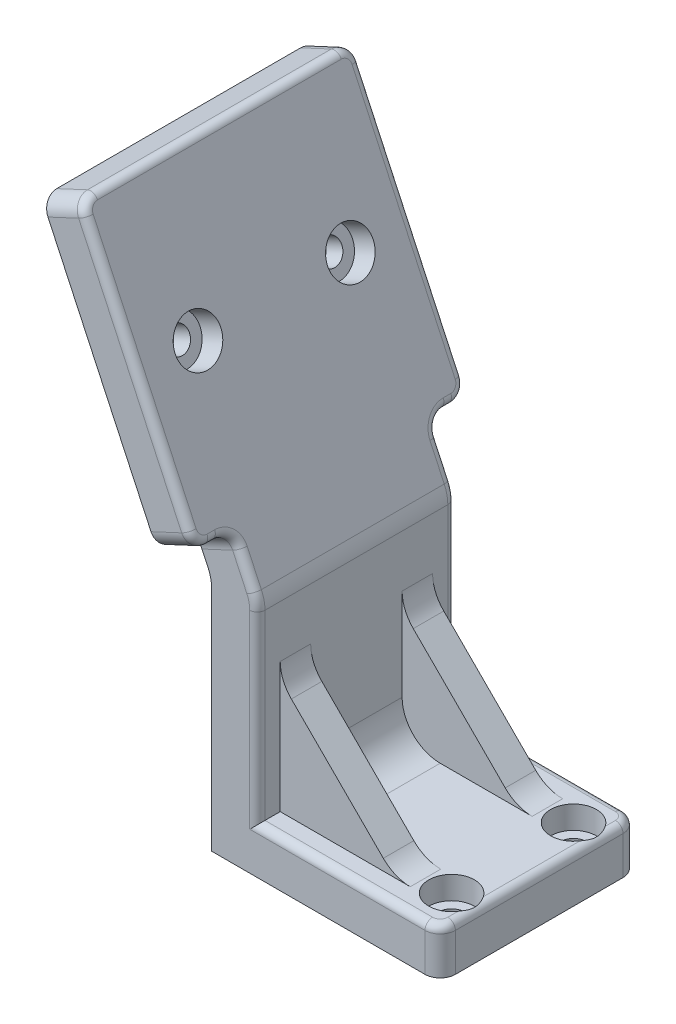
from build123d import *

# Parameters (mm, degrees)
SKETCH_1_W          = 30
SKETCH_1_H          = 26
SKETCH_1_R          = 1.7
EXTRUDE_1_DEPTH     = 6
SKETCH_15_W         = 6
SKETCH_15_H         = 26
EXTRUDE_4_DEPTH     = 25
EXTRUDE_5_DEPTH     = 26
SKETCH_17_W         = 36
SKETCH_17_H         = 36
SKETCH_17_R         = 1.6
EXTRUDE_6_DEPTH     = 5.437846722
FILLET_3_R          = 2
SKETCH_18_R         = 3
CUT_EXTRUDE_4_DEPTH = 3
SKETCH_19_R         = 3
CUT_EXTRUDE_5_DEPTH = 3
FILLET_4_R          = 1
FILLET_6_R          = 5
EXTRUDE_7_DEPTH     = 2
FILLET_7_R          = 5
FILLET_8_R          = 5


with BuildPart() as part:
    # 草图1 → 凸台-拉伸1 (new body)
    with BuildSketch(Plane(origin=(0, 0, 0), x_dir=(1, 0, 0), z_dir=(0, 1, 0))):
        Rectangle(SKETCH_1_W, SKETCH_1_H)
        with Locations(Location((11.5, 8, 0), (0, 0, 270))):
            Circle(SKETCH_1_R, mode=Mode.SUBTRACT)
        with Locations(Location((11.5, -8, 0), (0, 0, 90))):
            Circle(SKETCH_1_R, mode=Mode.SUBTRACT)
    extrude(amount=EXTRUDE_1_DEPTH)

    # 草图15 → 凸台-拉伸4 (add)
    with BuildSketch(Plane(origin=(0, 6, 0), x_dir=(1, 0, 0), z_dir=(0, 1, 0))):
        with Locations((-12, 0)):
            Rectangle(SKETCH_15_W, SKETCH_15_H)
    extrude(amount=EXTRUDE_4_DEPTH)

    # 草图16 → 凸台-拉伸5 (add)
    with BuildSketch(Plane.XY.offset(13)):
        Polygon((-9, 31), (-12.18472848, 37.829672265), (-17.113091309, 35.531538935), (-15, 31), align=None)
    extrude(amount=-EXTRUDE_5_DEPTH)

    # 草图17 → 凸台-拉伸6 (add)
    with BuildSketch(Plane(origin=(-0.447218204, -0.208541274, 0), x_dir=(0, 0, 1), z_dir=(-0.906307787036653, -0.4226182617406928, 0))):
        with Locations((0, 57.434815324)):
            Rectangle(SKETCH_17_W, SKETCH_17_H)
        with Locations(Location((10, 57.434815324, 0), (0, 0, 270))):
            Circle(SKETCH_17_R, mode=Mode.SUBTRACT)
        with Locations(Location((-10, 57.434815324, 0), (0, 0, 90))):
            Circle(SKETCH_17_R, mode=Mode.SUBTRACT)
    extrude(amount=-EXTRUDE_6_DEPTH)

    # 圆角3
    fillet_3_edges = [part.edges().sort_by_distance(p)[0] for p in [
        (-14.648909894, 36.6806056, 13),
        (-14.648909894, 36.6806056, -13),
        (-14.648909894, 36.6806056, 18),
        (-29.863167317, 69.307685933, 18),
        (-14.648909894, 36.6806056, -18),
        (-29.863167317, 69.307685933, -18),
        (15, 3, 13),
        (15, 3, -13),
    ]]
    fillet(fillet_3_edges, radius=FILLET_3_R)

    # 草图18 → 切除-拉伸4 (cut)
    with BuildSketch(Plane(origin=(4.481144625, 2.089592056, 0), x_dir=(0, 0, -1), z_dir=(0.9063077870366527, 0.42261826174069367, 0))):
        with Locations(Location((-10, 57.434815324, 0), (0, 0, 90))):
            Circle(SKETCH_18_R)
        with Locations(Location((10, 57.434815324, 0), (0, 0, 90))):
            Circle(SKETCH_18_R)
    extrude(amount=-CUT_EXTRUDE_4_DEPTH, mode=Mode.SUBTRACT)

    # 草图19 → 切除-拉伸5 (cut)
    with BuildSketch(Plane(origin=(0, 6, 0), x_dir=(1, 0, 0), z_dir=(0, 1, 0))):
        with Locations(Location((11.5, 8, 0), (0, 0, 270))):
            Circle(SKETCH_19_R)
        with Locations(Location((11.5, -8, 0), (0, 0, 270))):
            Circle(SKETCH_19_R)
    extrude(amount=-CUT_EXTRUDE_5_DEPTH, mode=Mode.SUBTRACT)

    # 圆角4
    # the kernel refuses this fillet: 1 mm, written as the material it takes off along each edge
    with BuildSketch(Plane(origin=(13, 6, 13), x_dir=(0, -1, 0), z_dir=(-1, 0, 0)), Plane(origin=(-9, 6, -13), x_dir=(0, -1, 0), z_dir=(1, 0, 0))) as fillet_4_piece_1:
        with BuildLine():
            CenterArc((FILLET_4_R, -FILLET_4_R), FILLET_4_R, 90, 90)
            Line((0, -FILLET_4_R), (0, 0))
            Line((0, 0), (FILLET_4_R, 0))
        make_face()
    extrude(amount=22, mode=Mode.SUBTRACT)
    with BuildSketch(Plane(origin=(-9, 6, 13), x_dir=(-1, 0, 0), z_dir=(0, 1, 0))) as fillet_4_piece_2:
        with BuildLine():
            CenterArc((FILLET_4_R, -FILLET_4_R), FILLET_4_R, 90, 90)
            Line((0, -FILLET_4_R), (0, 0))
            Line((0, 0), (FILLET_4_R, 0))
        make_face()
    extrude(amount=27.5, mode=Mode.SUBTRACT)
    with BuildSketch(Plane(origin=(-9, 6, -13), x_dir=(-1, 0, 0), z_dir=(0, 1, 0))) as fillet_4_piece_3:
        with BuildLine():
            CenterArc((FILLET_4_R, FILLET_4_R), FILLET_4_R, 180, 90)
            Line((0, FILLET_4_R), (0, 0))
            Line((0, 0), (FILLET_4_R, 0))
        make_face()
    extrude(amount=27.5, mode=Mode.SUBTRACT)
    with BuildSketch(Plane(origin=(-7.943454346, 28.734230532, 13), x_dir=(0, 0, -1), z_dir=(-0.4226182617406934, 0.9063077870366528, 0))) as fillet_4_piece_4:
        with BuildLine():
            CenterArc((FILLET_4_R, FILLET_4_R), FILLET_4_R, 180, 90)
            Line((0, FILLET_4_R), (0, 0))
            Line((0, 0), (FILLET_4_R, 0))
        make_face()
    extrude(amount=8.035709571, mode=Mode.SUBTRACT)
    with BuildSketch(Plane(origin=(-7.943454346, 28.734230532, -13), x_dir=(0, 0, 1), z_dir=(-0.4226182617406934, 0.9063077870366528, 0))) as fillet_4_piece_5:
        with BuildLine():
            CenterArc((FILLET_4_R, -FILLET_4_R), FILLET_4_R, 90, 90)
            Line((0, -FILLET_4_R), (0, 0))
            Line((0, 0), (FILLET_4_R, 0))
        make_face()
    extrude(amount=8.035709571, mode=Mode.SUBTRACT)
    with BuildSketch(Plane(origin=(15, 6, -11), x_dir=(-1, 0, 0), z_dir=(0, 0, 1))) as fillet_4_piece_6:
        with BuildLine():
            CenterArc((FILLET_4_R, FILLET_4_R), FILLET_4_R, 180, 90)
            Line((0, FILLET_4_R), (0, 0))
            Line((0, 0), (FILLET_4_R, 0))
        make_face()
    extrude(amount=22, mode=Mode.SUBTRACT)
    with BuildSketch(Plane(origin=(13, 6, 11), x_dir=(0, 0, 1), z_dir=(-1, 0, 0))) as fillet_4_piece_7:
        with BuildLine():
            CenterArc((2 - FILLET_4_R, -FILLET_4_R), FILLET_4_R, 0, 90)
            Line((2, -FILLET_4_R), (2, 0))
            Line((2, 0), (2 - FILLET_4_R, 0))
        make_face()
    revolve(axis=Axis((13, 6, 11), (0, 1, 0)), revolution_arc=90, mode=Mode.SUBTRACT)
    with BuildSketch(Plane(origin=(13, 6, -11), x_dir=(0, 0, -1), z_dir=(-1, 0, 0))) as fillet_4_piece_8:
        with BuildLine():
            CenterArc((2 - FILLET_4_R, FILLET_4_R), FILLET_4_R, 270, 90)
            Line((2 - FILLET_4_R, 0), (2, 0))
            Line((2, 0), (2, FILLET_4_R))
        make_face()
    revolve(axis=Axis((13, 6, -11), (0, -1, 0)), revolution_arc=90, mode=Mode.SUBTRACT)
    with BuildSketch(Plane(origin=(-12.18472848, 37.829672264, -15), x_dir=(-0.42261826174069467, 0.9063077870366523, 0), z_dir=(0, 0, -1)), Plane(origin=(-12.18472848, 37.829672264, 16), x_dir=(-0.42261826174069467, 0.9063077870366523, 0), z_dir=(0, 0, -1))) as fillet_4_piece_9:
        with BuildLine():
            CenterArc((FILLET_4_R, -FILLET_4_R), FILLET_4_R, 90, 90)
            Line((0, -FILLET_4_R), (0, 0))
            Line((0, 0), (FILLET_4_R, 0))
        make_face()
    extrude(amount=1, mode=Mode.SUBTRACT)
    with BuildSketch(Plane(origin=(-26.553749379, 68.644137024, 18), x_dir=(0, 0, -1), z_dir=(0.4226182617406928, -0.906307787036653, 0)), Plane(origin=(-13.029965003, 39.642287839, -18), x_dir=(0, 0, 1), z_dir=(-0.4226182617406928, 0.906307787036653, 0))) as fillet_4_piece_10:
        with BuildLine():
            CenterArc((FILLET_4_R, -FILLET_4_R), FILLET_4_R, 90, 90)
            Line((0, -FILLET_4_R), (0, 0))
            Line((0, 0), (FILLET_4_R, 0))
        make_face()
    extrude(amount=32, mode=Mode.SUBTRACT)
    with BuildSketch(Plane(origin=(-27.398985903, 70.456752598, -16), x_dir=(-0.9063077870366528, -0.4226182617406932, 0), z_dir=(0, 0, 1))) as fillet_4_piece_11:
        with BuildLine():
            CenterArc((FILLET_4_R, FILLET_4_R), FILLET_4_R, 180, 90)
            Line((0, FILLET_4_R), (0, 0))
            Line((0, 0), (FILLET_4_R, 0))
        make_face()
    extrude(amount=32, mode=Mode.SUBTRACT)
    with BuildSketch(Plane(origin=(-26.553749379, 68.644137024, -16), x_dir=(-0.42261826174069317, 0.9063077870366529, 0), z_dir=(0, 0, 1))) as fillet_4_piece_12:
        with BuildLine():
            CenterArc((2 - FILLET_4_R, FILLET_4_R), FILLET_4_R, 270, 90)
            Line((2 - FILLET_4_R, 0), (2, 0))
            Line((2, 0), (2, FILLET_4_R))
        make_face()
    revolve(axis=Axis((-26.553749379, 68.644137024, -16), (-0.906307787036653, -0.4226182617406928, 0)), revolution_arc=90, mode=Mode.SUBTRACT)
    with BuildSketch(Plane(origin=(-13.029965003, 39.642287839, -16), x_dir=(0, 0, -1), z_dir=(-0.4226182617406928, 0.906307787036653, 0))) as fillet_4_piece_13:
        with BuildLine():
            CenterArc((2 - FILLET_4_R, FILLET_4_R), FILLET_4_R, 270, 90)
            Line((2, FILLET_4_R), (2, 0))
            Line((2, 0), (2 - FILLET_4_R, 0))
        make_face()
    revolve(axis=Axis((-13.029965003, 39.642287839, -16), (-0.906307787036653, -0.4226182617406928, 0)), revolution_arc=90, mode=Mode.SUBTRACT)
    with BuildSketch(Plane(origin=(-13.029965003, 39.642287839, 16), x_dir=(0, 0, 1), z_dir=(-0.4226182617406928, 0.906307787036653, 0))) as fillet_4_piece_14:
        with BuildLine():
            CenterArc((2 - FILLET_4_R, -FILLET_4_R), FILLET_4_R, 360, 90)
            Line((2, -FILLET_4_R), (2, 0))
            Line((2, 0), (2 - FILLET_4_R, 0))
        make_face()
    revolve(axis=Axis((-13.029965003, 39.642287839, 16), (0.906307787036653, 0.4226182617406928, 0)), revolution_arc=90, mode=Mode.SUBTRACT)
    with BuildSketch(Plane(origin=(-26.553749379, 68.644137024, 16), x_dir=(-0.42261826174069317, 0.9063077870366529, 0), z_dir=(0, 0, -1))) as fillet_4_piece_15:
        with BuildLine():
            CenterArc((2 - FILLET_4_R, -FILLET_4_R), FILLET_4_R, 0, 90)
            Line((2 - FILLET_4_R, 0), (2, 0))
            Line((2, 0), (2, -FILLET_4_R))
        make_face()
    revolve(axis=Axis((-26.553749379, 68.644137024, 16), (0.906307787036653, 0.4226182617406928, 0)), revolution_arc=90, mode=Mode.SUBTRACT)
    with BuildSketch(Plane(origin=(-11.339491956, 36.01705669, -15), x_dir=(-0.42261826174069395, 0.9063077870366527, 0), z_dir=(0, 0, -1))) as fillet_4_piece_16:
        with BuildLine():
            CenterArc((2 + FILLET_4_R, -FILLET_4_R), FILLET_4_R, 90, 90)
            Line((2, -FILLET_4_R), (2, 0))
            Line((2, 0), (2 + FILLET_4_R, 0))
        make_face()
    revolve(axis=Axis((-11.339491956, 36.01705669, -15), (0.9063077870366527, 0.42261826174069356, 0)), revolution_arc=90, mode=Mode.SUBTRACT)
    with BuildSketch(Plane(origin=(-11.339491956, 36.01705669, 15), x_dir=(-0.42261826174069395, 0.9063077870366527, 0), z_dir=(0, 0, 1))) as fillet_4_piece_17:
        with BuildLine():
            CenterArc((2 + FILLET_4_R, FILLET_4_R), FILLET_4_R, 180, 90)
            Line((2, FILLET_4_R), (2, 0))
            Line((2, 0), (2 + FILLET_4_R, 0))
        make_face()
    revolve(axis=Axis((-11.339491956, 36.01705669, 15), (-0.9063077870366527, -0.42261826174069356, 0)), revolution_arc=90, mode=Mode.SUBTRACT)
    with BuildSketch(Plane(origin=(13, 6, 13), x_dir=(0, -1, 0), z_dir=(-1, 0, 0))) as fillet_4_piece_18a_section:
        with BuildLine():
            CenterArc((FILLET_4_R, -FILLET_4_R), FILLET_4_R, 90, 90)
            Line((0, -FILLET_4_R), (0, 0))
            Line((0, 0), (FILLET_4_R, 0))
        make_face()
    fillet_4_piece_18a = extrude(amount=24.5, mode=Mode.PRIVATE)
    fillet_4_piece_18a = split(fillet_4_piece_18a, bisect_by=Plane(origin=(-9, 5.773604886, 12.773604886), z_dir=(-1, 0, 0)), keep=Keep.TOP, mode=Mode.PRIVATE)
    with BuildSketch(Plane(origin=(-9, 3.5, 13), x_dir=(-1, 0, 0), z_dir=(0, 1, 0))) as fillet_4_piece_18b_section:
        with BuildLine():
            CenterArc((FILLET_4_R, -FILLET_4_R), FILLET_4_R, 90, 90)
            Line((0, -FILLET_4_R), (0, 0))
            Line((0, 0), (FILLET_4_R, 0))
        make_face()
    fillet_4_piece_18b = extrude(amount=30, mode=Mode.PRIVATE)
    fillet_4_piece_18b = split(fillet_4_piece_18b, bisect_by=Plane(origin=(-9.226395114, 6, 12.773604886), z_dir=(0, -1, 0)), keep=Keep.TOP, mode=Mode.PRIVATE)
    fillet_4_piece_18 = fillet_4_piece_18a & fillet_4_piece_18b
    add(fillet_4_piece_18, mode=Mode.SUBTRACT)
    with BuildSketch(Plane(origin=(-9, 3.5, -13), x_dir=(-1, 0, 0), z_dir=(0, 1, 0))) as fillet_4_piece_19a_section:
        with BuildLine():
            CenterArc((FILLET_4_R, FILLET_4_R), FILLET_4_R, 180, 90)
            Line((0, FILLET_4_R), (0, 0))
            Line((0, 0), (FILLET_4_R, 0))
        make_face()
    fillet_4_piece_19a = extrude(amount=30, mode=Mode.PRIVATE)
    fillet_4_piece_19a = split(fillet_4_piece_19a, bisect_by=Plane(origin=(-9.226395114, 6, -12.773604886), z_dir=(0, -1, 0)), keep=Keep.TOP, mode=Mode.PRIVATE)
    with BuildSketch(Plane(origin=(-11.5, 6, -13), x_dir=(0, -1, 0), z_dir=(1, 0, 0))) as fillet_4_piece_19b_section:
        with BuildLine():
            CenterArc((FILLET_4_R, -FILLET_4_R), FILLET_4_R, 90, 90)
            Line((0, -FILLET_4_R), (0, 0))
            Line((0, 0), (FILLET_4_R, 0))
        make_face()
    fillet_4_piece_19b = extrude(amount=24.5, mode=Mode.PRIVATE)
    fillet_4_piece_19b = split(fillet_4_piece_19b, bisect_by=Plane(origin=(-9, 5.773604886, -12.773604886), z_dir=(-1, 0, 0)), keep=Keep.TOP, mode=Mode.PRIVATE)
    fillet_4_piece_19 = fillet_4_piece_19a & fillet_4_piece_19b
    add(fillet_4_piece_19, mode=Mode.SUBTRACT)

    # 圆角6
    # the kernel refuses this fillet: 5 mm, written as the material it adds along each edge
    with BuildSketch(Plane(origin=(-15, 31, 13), x_dir=(0, -1, 0), z_dir=(0, 0, -1))) as fillet_6_piece_1:
        with BuildLine():
            CenterArc((FILLET_6_R * 0.221694662643, FILLET_6_R), FILLET_6_R, 245, 25)
            Line((-FILLET_6_R * 0.200923599098, FILLET_6_R * 0.0936922129633), (0, 0))
            Line((0, 0), (FILLET_6_R * 0.221694662643, 0))
        make_face()
    extrude(amount=26)
    # the kernel refuses this fillet: 5 mm, written as the material it takes off along each edge
    with BuildSketch(Plane(origin=(-14, 29.891526686, 13), x_dir=(1, 0, 0), z_dir=(0, -1, 0))) as fillet_6_2_piece_1:
        with BuildLine():
            CenterArc((4, -1), 1, 0, 90)
            Line((5, -1), (5, 0))
            Line((5, 0), (4, 0))
        make_face()
    revolve(axis=Axis((-14, 29.891526686, 13), (0, 0, 1)), revolution_arc=25, mode=Mode.SUBTRACT)
    with BuildSketch(Plane(origin=(-14, 29.891526686, -13), x_dir=(0.906307787036653, 0.4226182617406928, 0), z_dir=(-0.4226182617406928, 0.906307787036653, 0))) as fillet_6_2_piece_2:
        with BuildLine():
            CenterArc((4, -1), 1, 0, 90)
            Line((5, -1), (5, 0))
            Line((5, 0), (4, 0))
        make_face()
    revolve(axis=Axis((-14, 29.891526686, -13), (0, 0, -1)), revolution_arc=25, mode=Mode.SUBTRACT)
    with BuildSketch(Plane(origin=(-9, 30.999999999, -13), x_dir=(-0.422618261740692, 0.9063077870366535, 0), z_dir=(0, 0, 1))) as fillet_6_2_piece_3:
        with BuildLine():
            CenterArc((FILLET_6_R * 0.221694662643, FILLET_6_R), FILLET_6_R, 245, 25)
            Line((-FILLET_6_R * 0.200923599098, FILLET_6_R * 0.0936922129633), (0, 0))
            Line((0, 0), (FILLET_6_R * 0.221694662643, 0))
        make_face()
    extrude(amount=26, mode=Mode.SUBTRACT)

    # 草图20 → 凸台-拉伸7 (add, symmetric)
    with BuildSketch(Plane.XY.offset(8)):
        Polygon((-9, 21), (6, 6), (-9, 6), align=None)
    extrude_7 = extrude(amount=EXTRUDE_7_DEPTH, both=True)

    # 镜向1: 凸台-拉伸7 across plane
    add(extrude_7.mirror(Plane(origin=(0, 0, 0), x_dir=(1, 0, 0), z_dir=(0, 0, -1))))

    # 圆角7
    fillet_7_edges = [part.edges().sort_by_distance(p)[0] for p in [
        (-9, 21, 8),
        (6, 6, 8),
        (-9, 21, -8),
        (6, 6, -8),
    ]]
    fillet(fillet_7_edges, radius=FILLET_7_R)

    # 圆角8
    fillet_8_edges = [part.edges().sort_by_distance(p)[0] for p in [
        (-9, 6, 0),
    ]]
    fillet(fillet_8_edges, radius=FILLET_8_R)


solid = part.part
